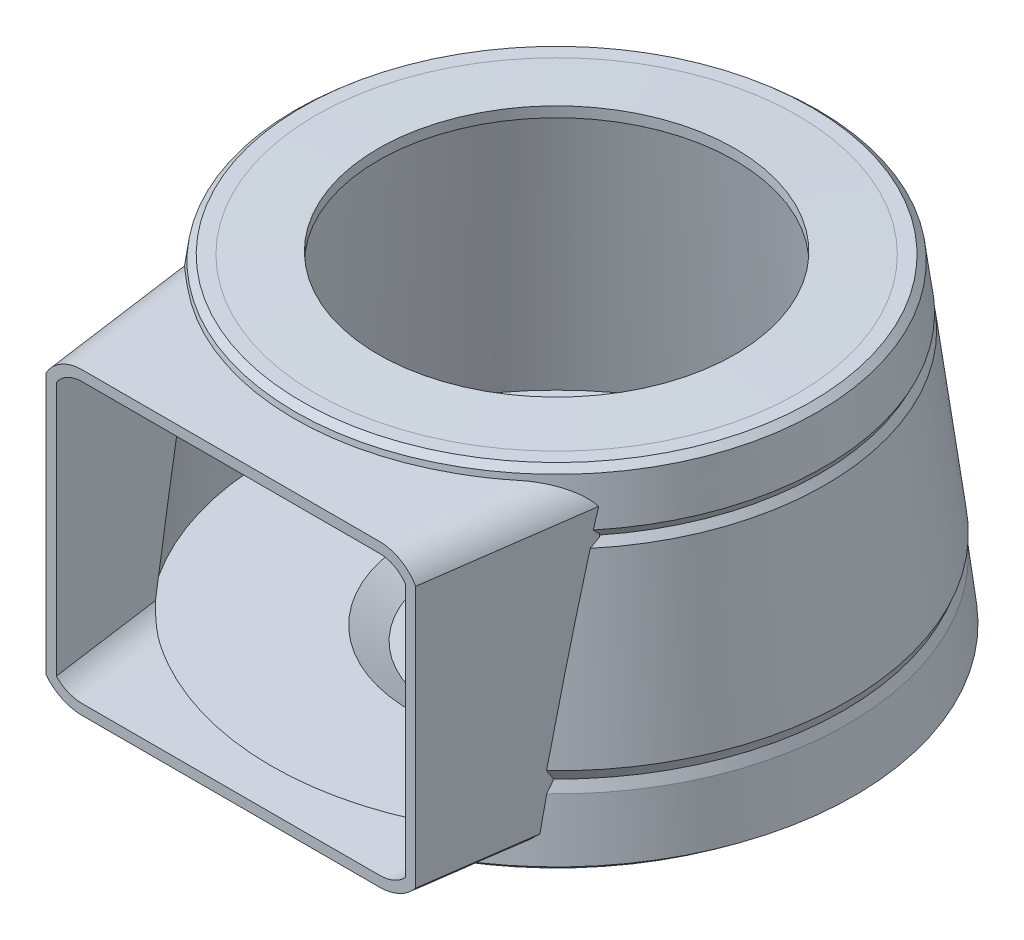
from build123d import *


with BuildPart() as part:
    # Sketch1 → Revolve1 (revolve)
    with BuildSketch(Plane(origin=(0, 0, 0), x_dir=(0, 0, -1), z_dir=(1, 0, 0))):
        Polygon((293.643558, 788.849578), (332.05547, 787.275286), (340.631526, 787.275286), (344.62212, 783.79828), (348.278196, 756.258076), (346.061538, 751.779294), (349.157544, 747.2172), (362.925106, 639.044696), (360.50982, 632.90577), (362.855002, 626.748048), (367.095786, 590.863944), (357.908352, 583.771248), (274.392136, 583.771248), (256.876296, 575.2338), (184.060084, 575.2338), (184.060084, 788.849578), align=None)
    revolve(axis=Axis((0, 575.2338, -184.060084), (0, 1, 0)))

    # Loft2: read off the stored shape, not the designer's step
    # Loft2: loft between two sections, ruled curve by curve
    loft2_from = [
        Edge.make_bspline([(105.23093, 596.391238, -83.043014), (113.814151703, 596.391238, -83.043014), (121.933618592, 600.294497099, -83.043014), (127.294386, 606.99777, -83.043014)], [0, 0, 0, 0, 1, 1, 1, 1], 3),
        Edge.make_bspline([(-127.294386, 606.99777, -83.043014), (-125.892022001, 605.244209759, -83.043014), (-122.817297806, 602.241783802, -83.043014), (-117.567114261, 598.981005063, -83.043014), (-111.74145761, 596.917311812, -83.043014), (-107.476280374, 596.391238, -83.043014), (-87.82784196, 596.391238, -83.043014), (-52.820904638, 596.391238, -83.043014), (0, 596.391238, -83.043014), (52.820904638, 596.391238, -83.043014), (87.82784196, 596.391238, -83.043014), (105.23093, 596.391238, -83.043014)], [0, 0, 0, 0, 0.028569069, 0.057138139, 0.085707208, 0.114276277, 0.114276277, 0.335707208, 0.557138139, 0.778569069, 1, 1, 1, 1], 3),
        Edge.make_bspline([(127.294386, 767.571998, -83.043014), (126.183927487, 769.498827639, -83.043014), (123.492978431, 773.003785544, -83.043014), (118.298624535, 777.041287913, -83.043014), (112.16643514, 779.666430857, -83.043014), (107.596681448, 780.321782, -83.043014), (87.834279771, 780.321782, -83.043014), (52.830790074, 780.321782, -83.043014), (0, 780.321782, -83.043014), (-52.830790074, 780.321782, -83.043014), (-87.834279771, 780.321782, -83.043014), (-107.596681448, 780.321782, -83.043014), (-112.16643514, 779.666430857, -83.043014), (-118.298624535, 777.041287913, -83.043014), (-123.492978431, 773.003785544, -83.043014), (-126.183927487, 769.498827639, -83.043014), (-127.294386, 767.571998, -83.043014)], [0, 0, 0, 0, 0.026727846, 0.053455692, 0.080183538, 0.106911383, 0.106911383, 0.303455692, 0.5, 0.696544308, 0.893088617, 0.893088617, 0.919816462, 0.946544308, 0.973272154, 1, 1, 1, 1], 3),
        Edge.make_line((127.294386, 767.571998, -83.043014), (127.294386, 606.99777, -83.043014)),
        Edge.make_line((-127.294386, 767.571998, -83.043014), (-127.294386, 606.99777, -83.043014)),
    ]
    loft2_to = [
        Edge.make_bspline([(91.475052, 596.391238, 16.064992), (100.058273703, 596.391238, 16.064992), (108.177740592, 600.294497099, 16.064992), (113.538508, 606.99777, 16.064992)], [0, 0, 0, 0, 1, 1, 1, 1], 3),
        Edge.make_bspline([(-113.538508, 606.99777, 16.064992), (-112.299776582, 605.448821106, 16.064992), (-109.383278518, 602.477565017, 16.064992), (-103.827521591, 598.947128706, 16.064992), (-97.600419393, 596.813208882, 16.064992), (-93.458407289, 596.391238, 16.064992), (-76.102615206, 596.391238, 16.064992), (-45.549947235, 596.391238, 16.064992), (0, 596.391238, 16.064992), (45.549947235, 596.391238, 16.064992), (76.102615206, 596.391238, 16.064992), (91.475052, 596.391238, 16.064992)], [0, 0, 0, 0, 0.028569069, 0.057138139, 0.085707208, 0.114276277, 0.114276277, 0.335707208, 0.557138139, 0.778569069, 1, 1, 1, 1], 3),
        Edge.make_bspline([(113.538508, 767.571998, 16.064992), (112.428049487, 769.498827639, 16.064992), (109.65937654, 773.121359093, 16.064992), (104.162233267, 777.287649684, 16.064992), (97.870805169, 779.802181362, 16.064992), (93.566351412, 780.321782, 16.064992), (76.096596066, 780.321782, 16.064992), (45.541142712, 780.321782, 16.064992), (0, 780.321782, 16.064992), (-45.541142712, 780.321782, 16.064992), (-76.096596066, 780.321782, 16.064992), (-93.566351412, 780.321782, 16.064992), (-97.870805169, 779.802181362, 16.064992), (-104.162233267, 777.287649684, 16.064992), (-109.65937654, 773.121359093, 16.064992), (-112.428049487, 769.498827639, 16.064992), (-113.538508, 767.571998, 16.064992)], [0, 0, 0, 0, 0.026727846, 0.053455692, 0.080183538, 0.106911383, 0.106911383, 0.303455692, 0.5, 0.696544308, 0.893088617, 0.893088617, 0.919816462, 0.946544308, 0.973272154, 1, 1, 1, 1], 3),
        Edge.make_line((113.538508, 767.571998, 16.064992), (113.538508, 606.99777, 16.064992)),
        Edge.make_line((-113.538508, 767.571998, 16.064992), (-113.538508, 606.99777, 16.064992)),
    ]
    loft2 = Solid(Shell([*[Face.make_surface_from_curves(loft2_from[k], loft2_to[k]) for k in range(5)], Face(Wire(loft2_from)), Face(Wire(loft2_to))]))
    add(loft2)

    # Sketch4 → Cut-Revolve1 (revolve, cut)
    with BuildSketch(Plane(origin=(0, 0, 0), x_dir=(0, 0, -1), z_dir=(1, 0, 0))):
        Polygon((293.643558, 788.849578), (293.643558, 782.499578), (338.2702451, 780.670576713), (360.789367896, 590.121248), (274.392136, 590.121248), (256.876296, 581.5838), (184.060084, 581.5838), (184.060084, 823.893476728), align=None)
    revolve(axis=Axis((0, 575.2338, -184.060084), (0, 1, 0)), mode=Mode.SUBTRACT)

    # Sketch5 → Cut-Loft1 section 0
    with BuildSketch(Plane.XY.offset(16.064992)):
        with BuildLine():
            Line((-91.475052, 602.741238), (91.475052, 602.741238))
            ThreePointArc((91.475052, 602.741238), (100.005431116, 604.4707943), (107.188508, 609.386294208))
            Line((107.188508, 609.386294208), (107.188508, 765.741393865))
            ThreePointArc((107.188508, 765.741393865), (100.344268261, 771.789630393), (91.475052, 773.971782))
            Line((91.475052, 773.971782), (-91.475052, 773.971782))
            ThreePointArc((-91.475052, 773.971782), (-100.344268261, 771.789630393), (-107.188508, 765.741393865))
            Line((-107.188508, 765.741393865), (-107.188508, 609.386294208))
            ThreePointArc((-107.188508, 609.386294208), (-100.005431116, 604.4707943), (-91.475052, 602.741238))
        make_face()
    # Sketch6 → Cut-Loft1 section 1
    with BuildSketch(Plane.XY.offset(-83.043014)):
        with BuildLine():
            ThreePointArc((105.23093, 773.971782), (114.100146261, 771.789630393), (120.944386, 765.741393865))
            Line((120.944386, 765.741393865), (120.944386, 609.386294208))
            ThreePointArc((120.944386, 609.386294208), (113.761309116, 604.4707943), (105.23093, 602.741238))
            Line((105.23093, 602.741238), (-105.23093, 602.741238))
            ThreePointArc((-105.23093, 602.741238), (-113.761309116, 604.4707943), (-120.944386, 609.386294208))
            Line((-120.944386, 609.386294208), (-120.944386, 765.741393865))
            ThreePointArc((-120.944386, 765.741393865), (-114.100146261, 771.789630393), (-105.23093, 773.971782))
            Line((-105.23093, 773.971782), (105.23093, 773.971782))
        make_face()
    loft(mode=Mode.SUBTRACT)


solid = part.part
